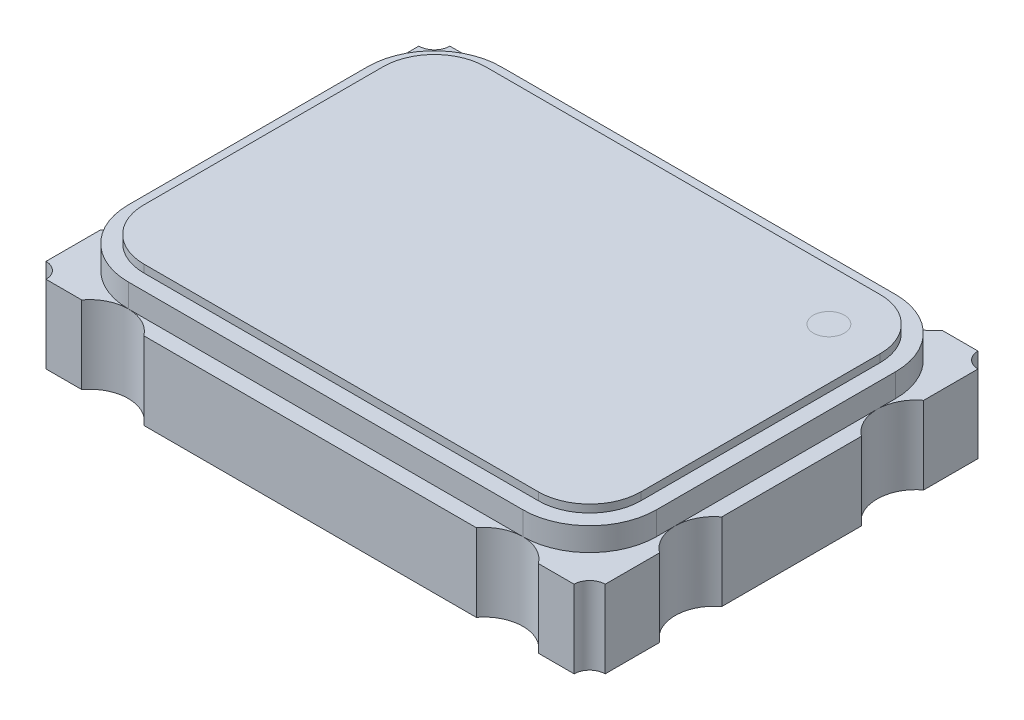
from build123d import *

# Parameters (mm, degrees)
EXTRUDE_1_DEPTH = 1
EXTRUDE_2_DEPTH = 0.3
EXTRUDE_3_DEPTH = 0.1


with BuildPart() as part:
    # Эскиз1 → Бобышка-Вытянуть1 (new body)
    with BuildSketch(Plane(origin=(0, 0, 0), x_dir=(1, 0, 0), z_dir=(0, 1, 0))):
        with BuildLine():
            Line((-3.4, 2.6), (-2.94, 2.6))
            ThreePointArc((-2.94, 2.6), (-2.54, 2.4), (-2.14, 2.6))
            Line((-2.14, 2.6), (2.14, 2.6))
            ThreePointArc((2.14, 2.6), (2.54, 2.4), (2.94, 2.6))
            Line((2.94, 2.6), (3.4, 2.6))
            ThreePointArc((3.4, 2.6), (3.458578644, 2.458578644), (3.6, 2.4))
            Line((3.6, 2.4), (3.6, 1.701107963))
            ThreePointArc((3.6, 1.701107963), (3.4, 1.3), (3.6, 0.898892037))
            Line((3.6, 0.898892037), (3.6, -0.898892037))
            ThreePointArc((3.6, -0.898892037), (3.4, -1.3), (3.6, -1.701107963))
            Line((3.6, -1.701107963), (3.6, -2.4))
            ThreePointArc((3.6, -2.4), (3.458578644, -2.458578644), (3.4, -2.6))
            Line((3.4, -2.6), (2.94, -2.6))
            ThreePointArc((2.94, -2.6), (2.54, -2.4), (2.14, -2.6))
            Line((2.14, -2.6), (-2.14, -2.6))
            ThreePointArc((-2.14, -2.6), (-2.54, -2.4), (-2.94, -2.6))
            Line((-2.94, -2.6), (-3.4, -2.6))
            ThreePointArc((-3.4, -2.6), (-3.458578644, -2.458578644), (-3.6, -2.4))
            Line((-3.6, -2.4), (-3.6, -1.701107963))
            ThreePointArc((-3.6, -1.701107963), (-3.4, -1.3), (-3.6, -0.898892037))
            Line((-3.6, -0.898892037), (-3.6, 0.898892037))
            ThreePointArc((-3.6, 0.898892037), (-3.4, 1.3), (-3.6, 1.701107963))
            Line((-3.6, 1.701107963), (-3.6, 2.4))
            ThreePointArc((-3.6, 2.4), (-3.458578644, 2.458578644), (-3.4, 2.6))
        make_face()
    extrude(amount=EXTRUDE_1_DEPTH)

    # Эскиз2 → Бобышка-Вытянуть2 (add)
    with BuildSketch(Plane(origin=(0, 1, 0), x_dir=(1, 0, 0), z_dir=(0, 1, 0))):
        with BuildLine():
            Line((-2.54, 2.4), (2.54, 2.4))
            ThreePointArc((2.54, 2.4), (3.148111832, 2.148111832), (3.4, 1.54))
            Line((3.4, 1.54), (3.4, -1.54))
            ThreePointArc((3.4, -1.54), (3.148111832, -2.148111832), (2.54, -2.4))
            Line((2.54, -2.4), (-2.54, -2.4))
            ThreePointArc((-2.54, -2.4), (-3.148111832, -2.148111832), (-3.4, -1.54))
            Line((-3.4, -1.54), (-3.4, 1.54))
            ThreePointArc((-3.4, 1.54), (-3.148111832, 2.148111832), (-2.54, 2.4))
        make_face()
    extrude(amount=EXTRUDE_2_DEPTH)

    # Эскиз3 → Бобышка-Вытянуть3 (add)
    with BuildSketch(Plane(origin=(0, 1.3, 0), x_dir=(1, 0, 0), z_dir=(0, 1, 0))):
        with BuildLine():
            Line((3.2, -1.54), (3.2, 1.54))
            ThreePointArc((3.2, 1.54), (3.006690476, 2.006690476), (2.54, 2.2))
            Line((2.54, 2.2), (-2.54, 2.2))
            ThreePointArc((-2.54, 2.2), (-3.006690476, 2.006690476), (-3.2, 1.54))
            Line((-3.2, 1.54), (-3.2, -1.54))
            ThreePointArc((-3.2, -1.54), (-3.006690476, -2.006690476), (-2.54, -2.2))
            Line((-2.54, -2.2), (2.54, -2.2))
            ThreePointArc((2.54, -2.2), (3.006690476, -2.006690476), (3.2, -1.54))
        make_face()
    extrude(amount=EXTRUDE_3_DEPTH)


solid = part.part
